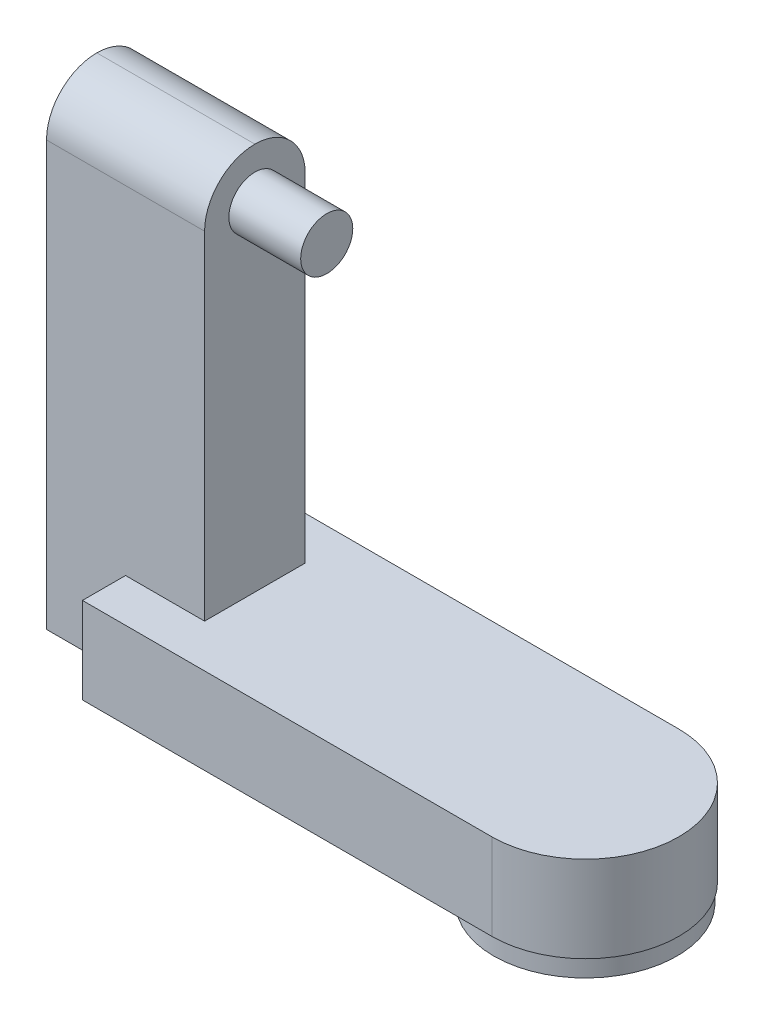
from build123d import *

# Parameters (mm, degrees)
BOSS_EXTRUDE2_DEPTH = 24
SKETCH2_R           = 25.5
BOSS_EXTRUDE3_DEPTH = 5
SKETCH3_W           = 44
SKETCH3_H           = 28
BOSS_EXTRUDE4_DEPTH = 132
FILLET2_R           = 14
FILLET5_R           = 14
SKETCH4_R           = 7.25
BOSS_EXTRUDE5_DEPTH = 20


with BuildPart() as part:
    # Sketch1 → Boss-Extrude2 (new body)
    with BuildSketch(Plane(origin=(0, 0, 0), x_dir=(1, 0, 0), z_dir=(0, 1, 0))):
        with BuildLine():
            Line((-114, 26), (0, 26))
            ThreePointArc((0, 26), (26, 0), (0, -26))
            Line((0, -26), (-114, -26))
            Line((-114, -26), (-114, 26))
        make_face()
    extrude(amount=BOSS_EXTRUDE2_DEPTH)

    # Sketch2 → Boss-Extrude3 (add)
    with BuildSketch(Plane.XZ):
        with Locations(Location((0, 0, 0), (0, 0, 90))):
            Circle(SKETCH2_R)
    extrude(amount=BOSS_EXTRUDE3_DEPTH)

    # Sketch3 → Boss-Extrude4 (add)
    with BuildSketch(Plane(origin=(0, 0, 0), x_dir=(1, 0, 0), z_dir=(0, 1, 0))):
        with Locations((-114, 0)):
            Rectangle(SKETCH3_W, SKETCH3_H)
    extrude(amount=BOSS_EXTRUDE4_DEPTH)

    # Fillet2
    fillet2_edges = [part.edges().sort_by_distance(p)[0] for p in [
        (-114, 132, 14),
    ]]
    fillet(fillet2_edges, radius=FILLET2_R)

    # Fillet5
    fillet5_edges = [part.edges().sort_by_distance(p)[0] for p in [
        (-114, 132, -14),
    ]]
    fillet(fillet5_edges, radius=FILLET5_R - 0.0001)  # a hair under: the kernel refuses the full size

    # Sketch4 → Boss-Extrude5 (add)
    with BuildSketch(Plane(origin=(-92, 0, 0), x_dir=(0, 0, -1), z_dir=(1, 0, 0))):
        with Locations(Location((0, 118, 0), (0, 0, 180))):
            Circle(SKETCH4_R)
    extrude(amount=BOSS_EXTRUDE5_DEPTH)


solid = part.part
